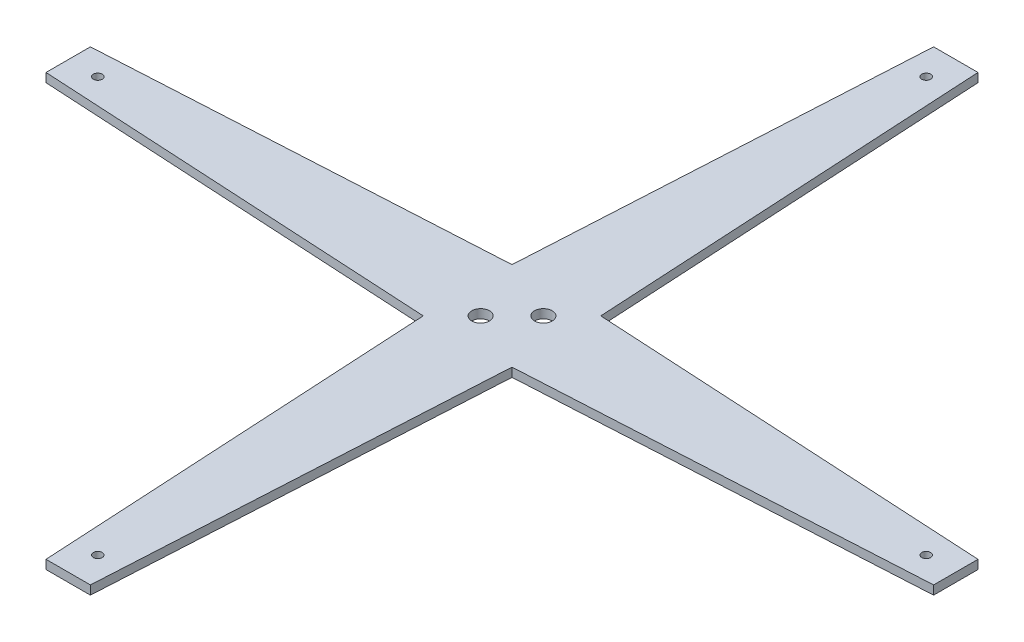
from build123d import *

# Parameters (mm, degrees)
SKETCH1_R           = 1.5
SKETCH1_R_2         = 3
BOSS_EXTRUDE1_DEPTH = 3


with BuildPart() as part:
    # Sketch1 → Boss-Extrude1 (new body)
    with BuildSketch(Plane(origin=(0, 0, 0), x_dir=(1, 0, 0), z_dir=(0, 1, 0))):
        Polygon((-15, 15), (-150, 7.5), (-150, -7.5), (-15, -15), (-7.5, -150), (7.5, -150), (15, -15), (150, -7.5), (150, 7.5), (15, 15), (7.5, 150), (-7.5, 150), align=None)
        with Locations((0, 140)):
            Circle(SKETCH1_R, mode=Mode.SUBTRACT)
        with Locations((140, 0)):
            Circle(SKETCH1_R, mode=Mode.SUBTRACT)
        with Locations((0, -140)):
            Circle(SKETCH1_R, mode=Mode.SUBTRACT)
        with Locations((-140, 0)):
            Circle(SKETCH1_R, mode=Mode.SUBTRACT)
        with Locations((-5.303300859, -5.303300859)):
            Circle(SKETCH1_R_2, mode=Mode.SUBTRACT)
        with Locations((5.303300859, 5.303300859)):
            Circle(SKETCH1_R_2, mode=Mode.SUBTRACT)
    extrude(amount=BOSS_EXTRUDE1_DEPTH)


solid = part.part
